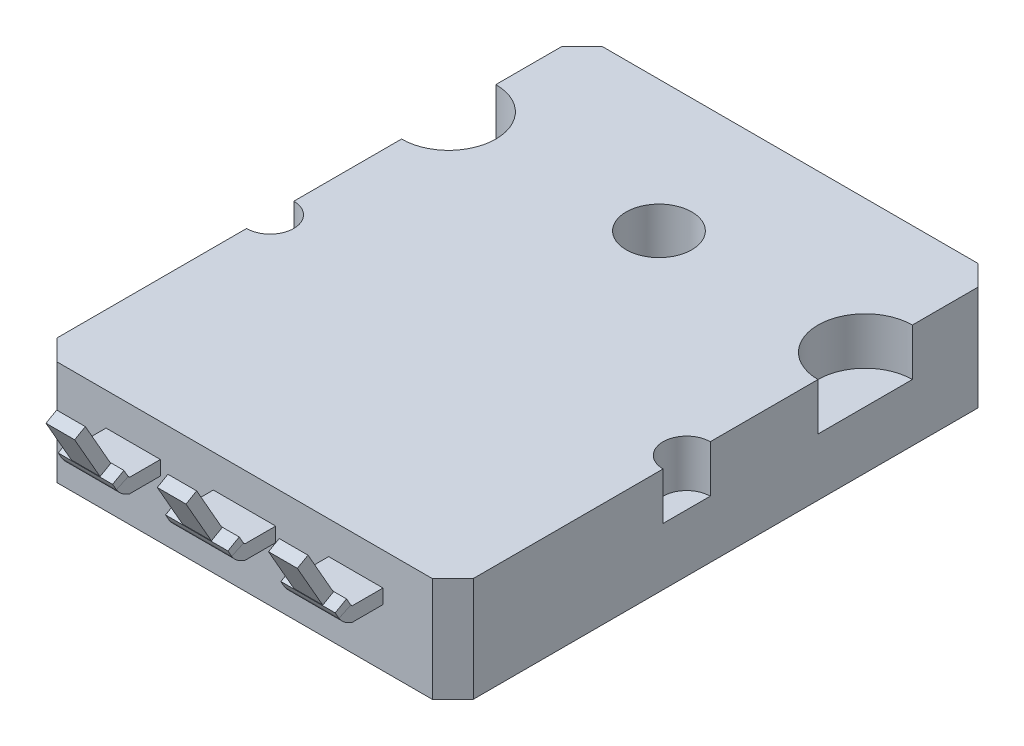
from build123d import *

# Parameters (mm, degrees)
SKETCH_1_W                  = 20.3
SKETCH_1_H                  = 26.6
EXTRUDE_1_DEPTH             = 5.1
HOLE_WIZARD_3_2_3_2_1_D     = 3.2
HOLE_WIZARD_2_3_2_3_1_D     = 2.3
HOLE_WIZARD_2_3_2_3_1_DEPTH = 2.3
HOLE_WIZARD_4_6_4_6_1_D     = 4.6
HOLE_WIZARD_4_6_4_6_1_DEPTH = 2.3
CHAMFER_1_SIZE              = 1
SKETCH_20_R                 = 1.6
CUT_EXTRUDE_7_DEPTH         = 1.5
SKETCH_2_W                  = 2.65
SKETCH_2_H                  = 0.7
SKETCH_2_W_2                = 3.04
EXTRUDE_2_DEPTH             = 1.5
SWEEP_START                 = -6.75
SWEEP_1_DEPTH               = 2.65
SWEEP_START_2               = -1.52
SWEEP_2_DEPTH               = 3.04
SWEEP_START_3               = 4.1
SWEEP_3_DEPTH               = 2.65
CUT_EXTRUDE_8_DEPTH         = 1
CUT_EXTRUDE_8_DEPTH_BACK    = 15.5
SKETCH_25_W                 = 1.3965698
SKETCH_25_H                 = 0.598451561
SKETCH_25_W_2               = 1.400753048
SKETCH_25_W_3               = 1.404395486
EXTRUDE_3_DEPTH             = 2.5


# Read off the part's stored shape, not the designer's step: По траектории1, По траектории2, По траектории3
with BuildPart() as part:
    # Эскиз1 → Бобышка-Вытянуть1 (new body)
    with BuildSketch(Plane(origin=(0, 2.3, 0), x_dir=(1, 0, 0), z_dir=(0, 1, 0))):
        Rectangle(SKETCH_1_W, SKETCH_1_H)
    extrude(amount=-EXTRUDE_1_DEPTH)

    # Диаметр отверстия Ø3.2 (3.2)1 (through all)
    with Locations(Plane(origin=(0, 2.3, 0), x_dir=(1, 0, 0), z_dir=(0, 1, 0))):
        with Locations((0, 6.9)):
            Hole(HOLE_WIZARD_3_2_3_2_1_D / 2)

    # Диаметр отверстия Ø2.3 (2.3)1
    with Locations(Plane(origin=(0, 2.3, 0), x_dir=(1, 0, 0), z_dir=(0, 1, 0))):
        with Locations((10.15, -1.9), (-10.15, -1.9)):
            Hole(HOLE_WIZARD_2_3_2_3_1_D / 2, depth=HOLE_WIZARD_2_3_2_3_1_DEPTH)

    # Диаметр отверстия Ø4.6 (4.6)1
    with Locations(Plane(origin=(0, 2.3, 0), x_dir=(1, 0, 0), z_dir=(0, 1, 0))):
        with Locations((10.15, 6.8), (-10.15, 6.8)):
            Hole(HOLE_WIZARD_4_6_4_6_1_D / 2, depth=HOLE_WIZARD_4_6_4_6_1_DEPTH)

    # Фаска1
    chamfer_1_edges = [part.edges().sort_by_distance(p)[0] for p in [
        (-10.15, -0.25, -13.3),
        (10.15, -0.25, -13.3),
        (10.15, -0.25, 13.3),
        (-10.15, -0.25, 13.3),
    ]]
    chamfer(chamfer_1_edges, length=CHAMFER_1_SIZE)

    # Эскиз20 → Вырез-Вытянуть7 (cut)
    with BuildSketch(Plane.XZ.offset(2.8)):
        Polygon((-8.735786438, -12.3), (8.735786438, -12.3), (9.15, -11.885786438), (9.15, 11.885786438), (8.735786438, 12.3), (-8.735786438, 12.3), (-9.15, 11.885786438), (-9.15, -11.885786438), align=None)
        with Locations(Location((0, -6.9, 0), (0, 0, 90))):
            Circle(SKETCH_20_R, mode=Mode.SUBTRACT)
    extrude(amount=-CUT_EXTRUDE_7_DEPTH, mode=Mode.SUBTRACT)

    # Эскиз2 → Бобышка-Вытянуть2 (add)
    with BuildSketch(Plane.XY.offset(13.3)):
        with Locations((-5.425, 0.35)):
            Rectangle(SKETCH_2_W, SKETCH_2_H)
        with Locations((0, 0.35)):
            Rectangle(SKETCH_2_W_2, SKETCH_2_H)
        with Locations((5.425, 0.35)):
            Rectangle(SKETCH_2_W, SKETCH_2_H)
    extrude(amount=EXTRUDE_2_DEPTH)

    # По траектории1 outline → По траектории1 (add)
    with BuildSketch(Plane.YZ.offset(SWEEP_START)):
        with BuildLine():
            Line((0.761891294, 14.869390662), (1.385375103, 15.225085604))
            Line((1.385375103, 15.225085604), (0.81420695, 15.629766886))
            Line((0.81420695, 15.629766886), (0.494271743, 15.44724517))
            Line((0.494271743, 15.44724517), (0.36086417, 15.351999112))
            ThreePointArc((0.36086417, 15.351999112), (0.144711062, 15.099351835), (0, 14.8))
            Line((0, 14.8), (0.7, 14.8))
            ThreePointArc((0.7, 14.8), (0.729738232, 14.835772255), (0.761891294, 14.869390662))
        make_face()
    extrude(amount=SWEEP_1_DEPTH)

    # По траектории2 outline → По траектории2 (add)
    with BuildSketch(Plane.YZ.offset(SWEEP_START_2)):
        with BuildLine():
            Line((0.761891294, 14.869390662), (1.385375103, 15.225085604))
            Line((1.385375103, 15.225085604), (0.81420695, 15.629766886))
            Line((0.81420695, 15.629766886), (0.494271743, 15.44724517))
            Line((0.494271743, 15.44724517), (0.36086417, 15.351999112))
            ThreePointArc((0.36086417, 15.351999112), (0.144711062, 15.099351835), (0, 14.8))
            Line((0, 14.8), (0.7, 14.8))
            ThreePointArc((0.7, 14.8), (0.729738232, 14.835772255), (0.761891294, 14.869390662))
        make_face()
    extrude(amount=SWEEP_2_DEPTH)

    # По траектории3 outline → По траектории3 (add)
    with BuildSketch(Plane.YZ.offset(SWEEP_START_3)):
        with BuildLine():
            Line((0.761891294, 14.869390662), (1.385375103, 15.225085604))
            Line((1.385375103, 15.225085604), (0.81420695, 15.629766886))
            Line((0.81420695, 15.629766886), (0.494271743, 15.44724517))
            Line((0.494271743, 15.44724517), (0.36086417, 15.351999112))
            ThreePointArc((0.36086417, 15.351999112), (0.144711062, 15.099351835), (0, 14.8))
            Line((0, 14.8), (0.7, 14.8))
            ThreePointArc((0.7, 14.8), (0.729738232, 14.835772255), (0.761891294, 14.869390662))
        make_face()
    extrude(amount=SWEEP_3_DEPTH)

    # Эскиз24 → Вырез-Вытянуть8 (cut, two sides: drawn at the far end of the back side and taken through both)
    with BuildSketch(Plane.ZY.offset(6.75).offset(-CUT_EXTRUDE_8_DEPTH_BACK)):
        Polygon((15.629766886, 0.81420695), (15.0115294, 1.166908885), (15.187532371, 1.475417638), (15.841474348, 1.102346438), (15.665471376, 0.793837685), align=None)
    extrude(amount=CUT_EXTRUDE_8_DEPTH + CUT_EXTRUDE_8_DEPTH_BACK, mode=Mode.SUBTRACT)

    # Эскиз25 → Бобышка-Вытянуть3 (add)
    with BuildSketch(Plane(origin=(0, 7.341514488, 4.188303737), x_dir=(1, 0, 0), z_dir=(0, 0.8685919072443863, 0.49552810078698817))):
        with Locations((-5.425, -12.855160228)):
            Rectangle(SKETCH_25_W, SKETCH_25_H)
        with Locations((0, -12.855160228)):
            Rectangle(SKETCH_25_W_2, SKETCH_25_H)
        with Locations((5.425, -12.855160228)):
            Rectangle(SKETCH_25_W_3, SKETCH_25_H)
    extrude(amount=EXTRUDE_3_DEPTH)


solid = part.part
